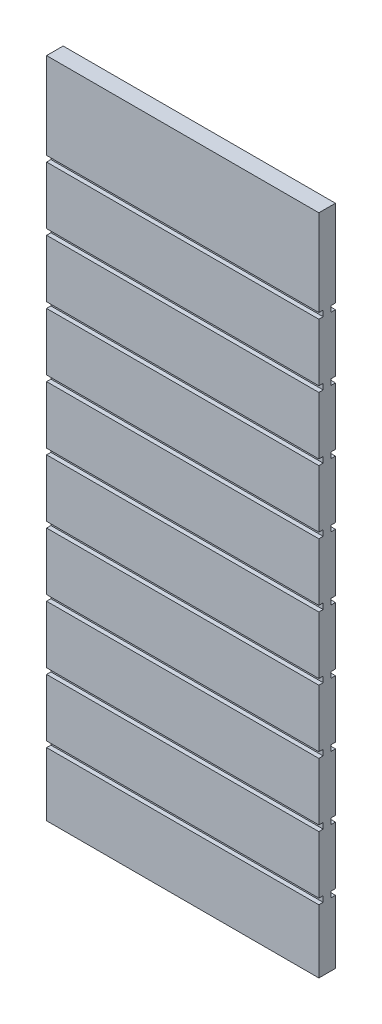
from build123d import *

# Parameters (mm, degrees)
PARTSCAB_REFERENCE_START = -1615.650675561
PARTSCAB_REFERENCE_DEPTH = 1475.316666667
SKETCH1_OUTSIDE_W        = 1806.569
SKETCH1_OUTSIDE_H        = 1061.502
SKETCH1_OUTSIDE_W_2      = 300.0375
SKETCH1_OUTSIDE_H_2      = 730.25
CUT_EXTRUDE1_DEPTH       = 1820.964329577


# Read off the part's stored shape, not the designer's step: PartsCab_Reference
with BuildPart() as part:
    # PartsCab_Reference outline → PartsCab_Reference (new body)
    with BuildSketch(Plane.YZ.offset(PARTSCAB_REFERENCE_START)):
        Polygon((107.371492578, 9.178125), (107.371492578, -9.078125), (177.221492578, -9.078125), (177.221492578, -4.315625), (183.571492578, -4.315625), (183.571492578, -9.078125), (247.071492578, -9.078125), (247.071492578, -4.315625), (253.421492578, -4.315625), (253.421492578, -9.078125), (316.921492578, -9.078125), (316.921492578, -4.315625), (323.271492578, -4.315625), (323.271492578, -9.078125), (386.771492578, -9.078125), (386.771492578, -4.315625), (393.121492578, -4.315625), (393.121492578, -9.078125), (456.621492578, -9.078125), (456.621492578, -4.315625), (462.971492578, -4.315625), (462.971492578, -9.078125), (526.471492578, -9.078125), (526.471492578, -4.315625), (532.821492578, -4.315625), (532.821492578, -9.078125), (596.321492578, -9.078125), (596.321492578, -4.315625), (602.671492578, -4.315625), (602.671492578, -9.078125), (666.171492578, -9.078125), (666.171492578, -4.315625), (672.521492578, -4.315625), (672.521492578, -9.078125), (736.021492578, -9.078125), (736.021492578, -4.315625), (742.371492578, -4.315625), (742.371492578, -9.078125), (837.621492578, -9.078125), (837.621492578, 9.178125), (742.371492578, 9.178125), (742.371492578, 4.415625), (736.021492578, 4.415625), (736.021492578, 9.178125), (672.521492578, 9.178125), (672.521492578, 4.415625), (666.171492578, 4.415625), (666.171492578, 9.178125), (602.671492578, 9.178125), (602.671492578, 4.415625), (596.321492578, 4.415625), (596.321492578, 9.178125), (532.821492578, 9.178125), (532.821492578, 4.415625), (526.471492578, 4.415625), (526.471492578, 9.178125), (462.971492578, 9.178125), (462.971492578, 4.415625), (456.621492578, 4.415625), (456.621492578, 9.178125), (393.121492578, 9.178125), (393.121492578, 4.415625), (386.771492578, 4.415625), (386.771492578, 9.178125), (323.271492578, 9.178125), (323.271492578, 4.415625), (316.921492578, 4.415625), (316.921492578, 9.178125), (253.421492578, 9.178125), (253.421492578, 4.415625), (247.071492578, 4.415625), (247.071492578, 9.178125), (183.571492578, 9.178125), (183.571492578, 4.415625), (177.221492578, 4.415625), (177.221492578, 9.178125), align=None)
    extrude(amount=PARTSCAB_REFERENCE_DEPTH)

    # Sketch1 outside → Cut-Extrude1 (cut, through all)
    with BuildSketch(Plane.XY.offset(9.178125)):
        with Locations((-877.9925, 472.496)):
            Rectangle(SKETCH1_OUTSIDE_W, SKETCH1_OUTSIDE_H)
        with Locations((-290.352758894, 472.496492578)):
            Rectangle(SKETCH1_OUTSIDE_W_2, SKETCH1_OUTSIDE_H_2, mode=Mode.SUBTRACT)
    extrude(amount=-CUT_EXTRUDE1_DEPTH, mode=Mode.SUBTRACT)


solid = part.part
